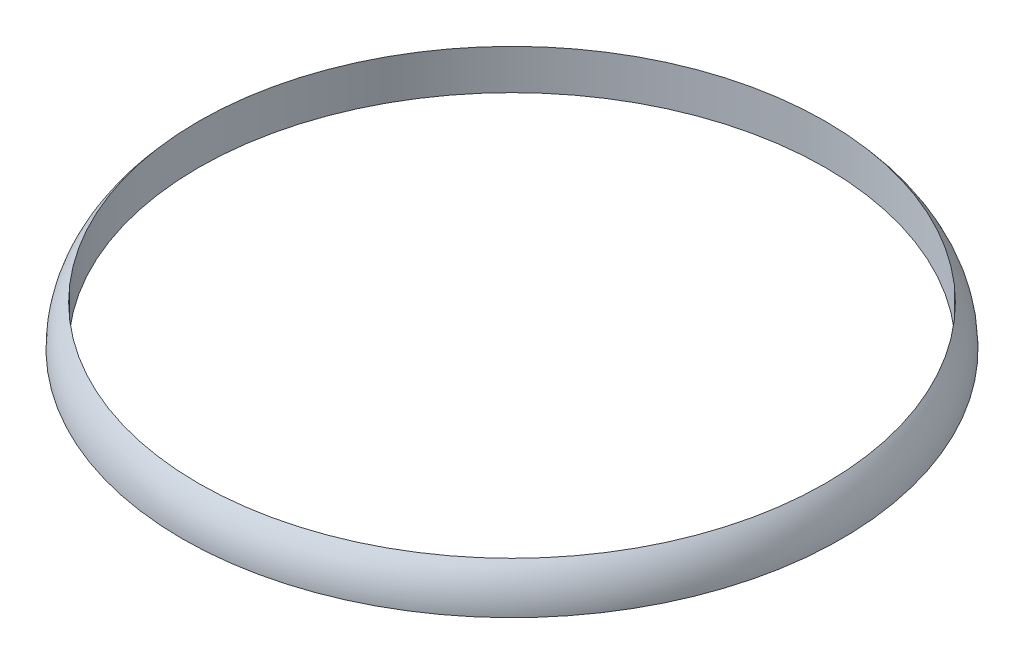
from build123d import *


with BuildPart() as part:
    # Sketch1 → Revolve1 (revolve)
    with BuildSketch(Plane(origin=(0, 0, 0), x_dir=(0, 0, -1), z_dir=(1, 0, 0))):
        with BuildLine():
            Line((78.2, 0), (78.2, 10))
            ThreePointArc((78.2, 10), (81.162912018, 5.385164807), (82.2, 0))
            Line((82.2, 0), (78.2, 0))
        make_face()
    revolve(axis=Axis((0, 0, 0), (0, 1, 0)))


solid = part.part
